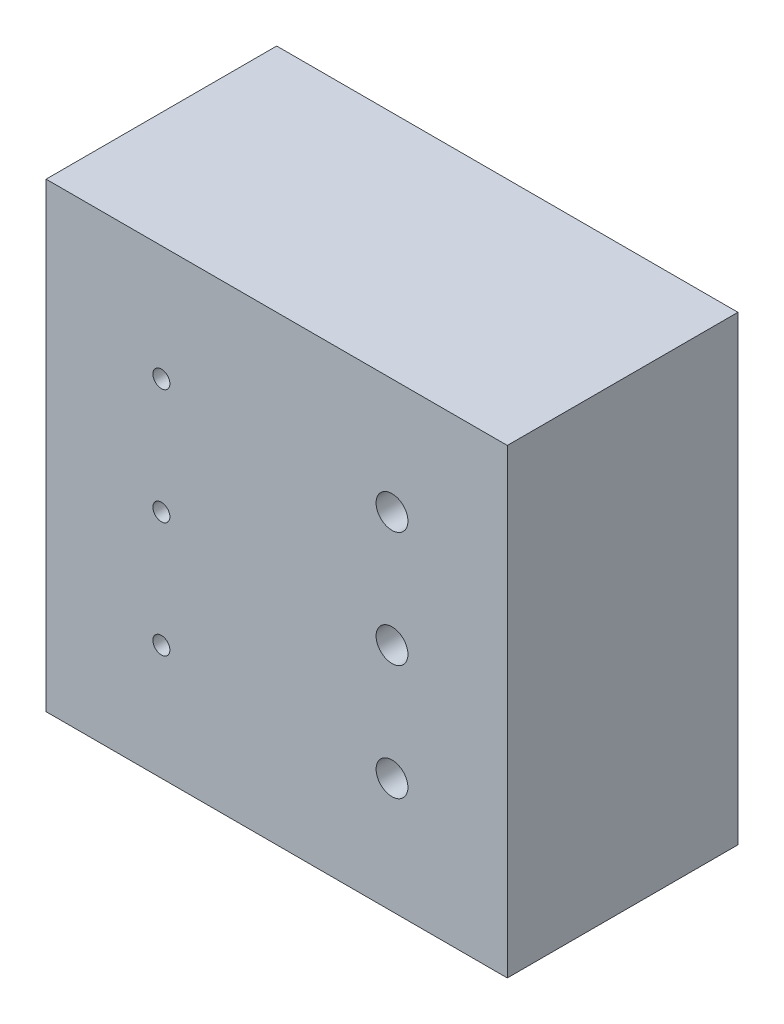
from build123d import *

# Parameters (mm, degrees)
SKETCH1_W            = 100
SKETCH1_H            = 100
BLOCK_EXTRUDE_DEPTH  = 50
SKETCH3_R            = 3.45
SKETCH3_R_2          = 1.84
HOLE_ARRAY_2X3_DEPTH = 87.602540378


with BuildPart() as part:
    # Sketch1 → Block-Extrude (new body)
    with BuildSketch(Plane.XY):
        Rectangle(SKETCH1_W, SKETCH1_H)
    extrude(amount=BLOCK_EXTRUDE_DEPTH)

    # Sketch3 → Hole-Array-2x3 (cut, through all)
    with BuildSketch(Plane.XY.offset(50)):
        with Locations((25, 25)):
            Circle(SKETCH3_R)
        with Locations((25, -25)):
            Circle(SKETCH3_R)
        with Locations((-25, 25)):
            Circle(SKETCH3_R_2)
        with Locations((-25, -25)):
            Circle(SKETCH3_R_2)
        with Locations((-25, 0)):
            Circle(SKETCH3_R_2)
        with Locations((25, 0)):
            Circle(SKETCH3_R)
    extrude(amount=-HOLE_ARRAY_2X3_DEPTH, mode=Mode.SUBTRACT)


solid = part.part
